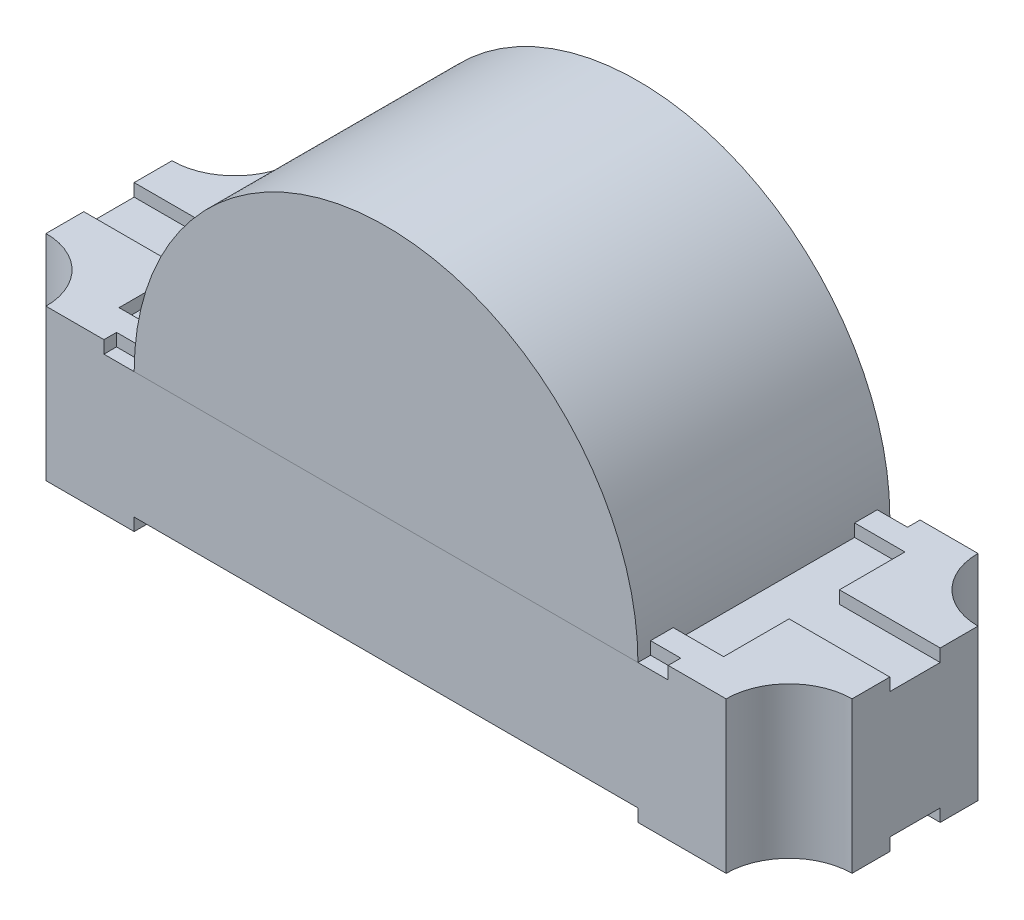
from build123d import *

# Parameters (mm, degrees)
EXTRUDE_1_DEPTH     = 1
CUT_EXTRUDE_1_DEPTH = 0.5
EXTRUDE_2_DEPTH     = 0.05
EXTRUDE_4_DEPTH     = 0.05


# Read off the part's stored shape, not the designer's step: Разделить1
with BuildPart() as part:
    # Эскиз1 → Бобышка-Вытянуть1 (new body)
    with BuildSketch(Plane.XY):
        with BuildLine():
            Line((-1.6, 0.25), (-1, 0.25))
            ThreePointArc((-1, 0.25), (0, 1.25), (1, 0.25))
            Line((1, 0.25), (1.6, 0.25))
            Line((1.6, 0.25), (1.6, -0.25))
            Line((1.6, -0.25), (-1.6, -0.25))
            Line((-1.6, -0.25), (-1.6, 0.25))
        make_face()
    extrude(amount=EXTRUDE_1_DEPTH)


with BuildPart() as body_2:
    # Split Bodies 1: the piece on the far side of the plane
    add(part.part)
    split(bisect_by=Plane(origin=(0, 0.25, 0), x_dir=(1, 0, 0), z_dir=(0, 1, 0)), keep=Keep.BOTTOM)

    # Эскиз2 → Вырез-Вытянуть1 (cut)
    with BuildSketch(Plane.XZ.offset(0.25)):
        with BuildLine():
            Line((-1.35, 0), (-1.6, 0))
            Line((-1.6, 0), (-1.6, 0.25))
            ThreePointArc((-1.6, 0.25), (-1.423223305, 0.176776695), (-1.35, 0))
        make_face()
        with BuildLine():
            Line((-1.35, 1), (-1.6, 1))
            Line((-1.6, 1), (-1.6, 0.75))
            ThreePointArc((-1.6, 0.75), (-1.423223305, 0.823223305), (-1.35, 1))
        make_face()
        with BuildLine():
            Line((1.6, 0.75), (1.6, 1))
            Line((1.6, 1), (1.35, 1))
            ThreePointArc((1.35, 1), (1.423223305, 0.823223305), (1.6, 0.75))
        make_face()
        with BuildLine():
            Line((1.6, 0.25), (1.6, 0))
            Line((1.6, 0), (1.35, 0))
            ThreePointArc((1.35, 0), (1.423223305, 0.176776695), (1.6, 0.25))
        make_face()
    extrude(amount=-CUT_EXTRUDE_1_DEPTH, mode=Mode.SUBTRACT)

    # Эскиз3 → Бобышка-Вытянуть2 (add)
    with BuildSketch(Plane.XZ.offset(0.25)):
        with BuildLine():
            Line((-1, 0), (-1, 0.4))
            Line((-1, 0.4), (-1.6, 0.4))
            Line((-1.6, 0.4), (-1.6, 0.25))
            ThreePointArc((-1.6, 0.25), (-1.423223305, 0.176776695), (-1.35, 0))
            Line((-1.35, 0), (-1, 0))
        make_face()
        with BuildLine():
            Line((1, 0), (1, 0.4))
            Line((1, 0.4), (1.6, 0.4))
            Line((1.6, 0.4), (1.6, 0.25))
            ThreePointArc((1.6, 0.25), (1.423223305, 0.176776695), (1.35, 0))
            Line((1.35, 0), (1, 0))
        make_face()
        with BuildLine():
            Line((1, 1), (1, 0.95))
            Line((1, 0.95), (0.295, 0.95))
            Line((0.295, 0.95), (0.295, 0.45))
            Line((0.295, 0.45), (0.17, 0.45))
            Line((0.17, 0.45), (0.17, 0))
            Line((0.17, 0), (0.67, 0))
            Line((0.67, 0), (0.67, 0.45))
            Line((0.67, 0.45), (0.545, 0.45))
            Line((0.545, 0.45), (0.545, 0.86))
            Line((0.545, 0.86), (1, 0.86))
            Line((1, 0.86), (1, 0.6))
            Line((1, 0.6), (1.6, 0.6))
            Line((1.6, 0.6), (1.6, 0.75))
            ThreePointArc((1.6, 0.75), (1.423223305, 0.823223305), (1.35, 1))
            Line((1.35, 1), (1, 1))
        make_face()
        with BuildLine():
            Line((-1.35, 1), (-1, 1))
            Line((-1, 1), (-1, 0.95))
            Line((-1, 0.95), (-0.295, 0.95))
            Line((-0.295, 0.95), (-0.295, 0.45))
            Line((-0.295, 0.45), (-0.17, 0.45))
            Line((-0.17, 0.45), (-0.17, 0))
            Line((-0.17, 0), (-0.67, 0))
            Line((-0.67, 0), (-0.67, 0.45))
            Line((-0.67, 0.45), (-0.545, 0.45))
            Line((-0.545, 0.45), (-0.545, 0.86))
            Line((-0.545, 0.86), (-1, 0.86))
            Line((-1, 0.86), (-1, 0.6))
            Line((-1, 0.6), (-1.6, 0.6))
            Line((-1.6, 0.6), (-1.6, 0.75))
            ThreePointArc((-1.6, 0.75), (-1.423223305, 0.823223305), (-1.35, 1))
        make_face()
    extrude(amount=EXTRUDE_2_DEPTH)

    # Эскиз4 → Бобышка-Вытянуть4 (add)
    with BuildSketch(Plane(origin=(0, 0.25, 0), x_dir=(1, 0, 0), z_dir=(0, 1, 0))):
        with BuildLine():
            Line((1.6, -0.4), (1.2, -0.4))
            Line((1.2, -0.4), (1.2, -0.14))
            Line((1.2, -0.14), (1, -0.14))
            Line((1, -0.14), (1, -0.05))
            Line((1, -0.05), (1.12, -0.05))
            Line((1.12, -0.05), (1.12, 0))
            Line((1.12, 0), (1.35, 0))
            ThreePointArc((1.35, 0), (1.423223305, -0.176776695), (1.6, -0.25))
            Line((1.6, -0.25), (1.6, -0.4))
        make_face()
        with BuildLine():
            Line((1.6, -0.6), (1.2, -0.6))
            Line((1.2, -0.6), (1.2, -0.86))
            Line((1.2, -0.86), (1, -0.86))
            Line((1, -0.86), (1, -0.95))
            Line((1, -0.95), (1.12, -0.95))
            Line((1.12, -0.95), (1.12, -1))
            Line((1.12, -1), (1.35, -1))
            ThreePointArc((1.35, -1), (1.423223305, -0.823223305), (1.6, -0.75))
            Line((1.6, -0.75), (1.6, -0.6))
        make_face()
        with BuildLine():
            Line((-1.6, -0.25), (-1.6, -0.4))
            Line((-1.6, -0.4), (-1.2, -0.4))
            Line((-1.2, -0.4), (-1.2, -0.14))
            Line((-1.2, -0.14), (-1, -0.14))
            Line((-1, -0.14), (-1, -0.05))
            Line((-1, -0.05), (-1.12, -0.05))
            Line((-1.12, -0.05), (-1.12, 0))
            Line((-1.12, 0), (-1.35, 0))
            ThreePointArc((-1.35, 0), (-1.423223305, -0.176776695), (-1.6, -0.25))
        make_face()
        with BuildLine():
            Line((-1.35, -1), (-1.12, -1))
            Line((-1.12, -1), (-1.12, -0.95))
            Line((-1.12, -0.95), (-1, -0.95))
            Line((-1, -0.95), (-1, -0.86))
            Line((-1, -0.86), (-1.2, -0.86))
            Line((-1.2, -0.86), (-1.2, -0.6))
            Line((-1.2, -0.6), (-1.6, -0.6))
            Line((-1.6, -0.6), (-1.6, -0.75))
            ThreePointArc((-1.6, -0.75), (-1.423223305, -0.823223305), (-1.35, -1))
        make_face()
    extrude(amount=EXTRUDE_4_DEPTH)


with BuildPart() as part_1:
    add(part.part)

    # Split Bodies 1
    split(bisect_by=Plane(origin=(0, 0.25, 0), x_dir=(1, 0, 0), z_dir=(0, 1, 0)), keep=Keep.TOP)


solid = Compound([body_2.part, part_1.part])
